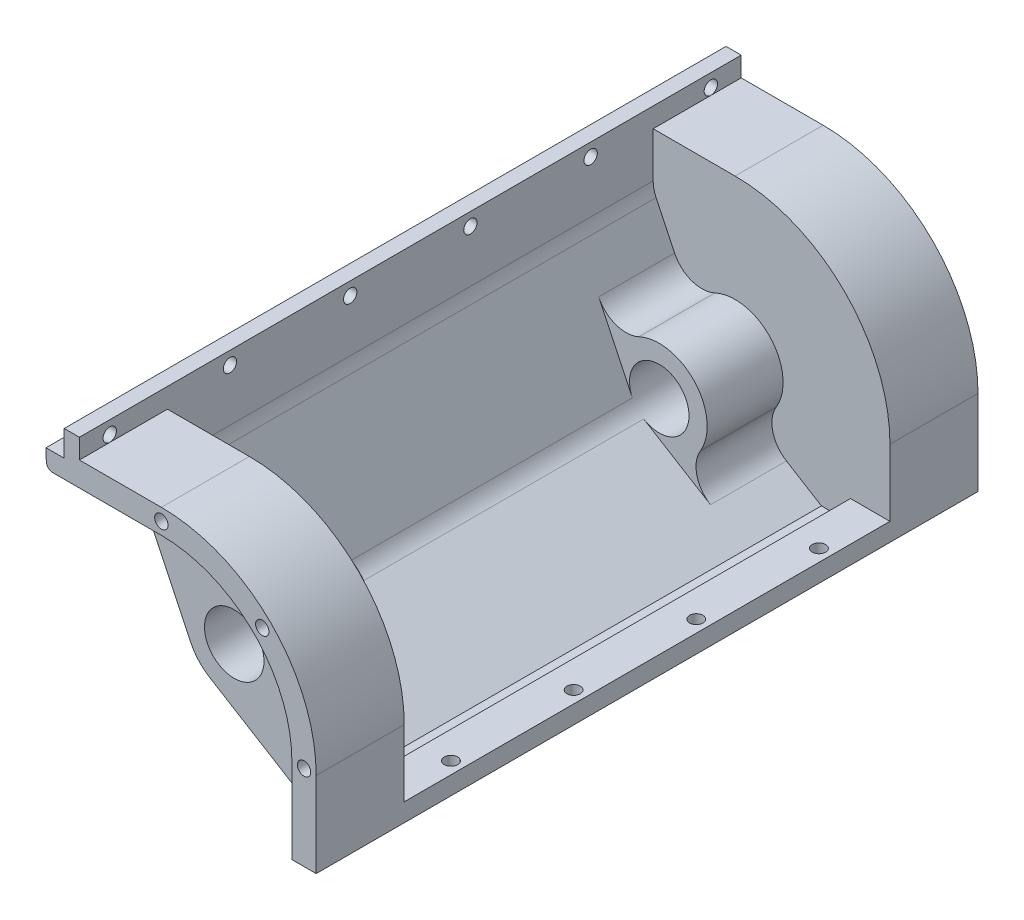
from build123d import *

# Parameters (mm, degrees)
EXTRUDE_1_DEPTH          = 24
SKETCH_3_W               = 8
SKETCH_3_H               = 5
SKETCH_3_H_2             = 6
EXTRUDE_2_DEPTH          = 5
SKETCH_3_4_W             = 8
SKETCH_3_4_H             = 6
EXTRUDE_3_DEPTH          = 85
SKETCH_3_5_W             = 8
SKETCH_3_5_H             = 5
EXTRUDE_5_DEPTH          = 30
SKETCH_4_R               = 15.8
SKETCH_4_R_2             = 9.8
EXTRUDE_4_DEPTH          = 30
FILLET_1_R               = 10
FILLET_2_R               = 4.5
FILLET_3_R               = 20
FILLET_4_R               = 8
FILLET_5_R               = 2
CUT_EXTRUDE_1_DEPTH      = 414.364246156
CUT_EXTRUDE_1_DEPTH_BACK = 414.364246156
SKETCH_5_R               = 2.2
SKETCH_7_R               = 2.2
CUT_EXTRUDE_2_DEPTH      = 10
SKETCH_8_R               = 2.2
CUT_EXTRUDE_3_DEPTH      = 10


with BuildPart() as part:
    # Эскиз1 → Бобышка-Вытянуть1 (new body)
    with BuildSketch(Plane.XY):
        with BuildLine():
            Line((-62, -308), (-94, -308))
            Line((-94, -308), (-100, -308))
            Line((-100, -308), (-100, -302))
            Line((-100, -302), (-94, -302))
            Line((-94, -302), (-94, -293.5))
            Line((-94, -293.5), (-89, -293.5))
            Line((-89, -293.5), (-89, -300))
            Line((-89, -300), (-62, -300))
            ThreePointArc((-62, -300), (-25.937554159, -314.937554159), (-11, -351))
            Line((-11, -351), (-11, -379))
            Line((-11, -379), (-19, -379))
            Line((-19, -379), (-19, -351))
            ThreePointArc((-19, -351), (-31.594408409, -320.594408409), (-62, -308))
        make_face()
    extrude(amount=EXTRUDE_1_DEPTH)

    # Эскиз3 → Бобышка-Вытянуть2 (add)
    with BuildSketch(Plane.XY.offset(24)):
        with BuildLine():
            Line((-19, -351), (-19, -373))
            Line((-19, -373), (-11, -373))
            Line((-11, -373), (-11, -351))
            ThreePointArc((-11, -351), (-25.937554159, -314.937554159), (-62, -300))
            Line((-62, -300), (-89, -300))
            Line((-89, -300), (-89, -308))
            Line((-89, -308), (-62, -308))
            ThreePointArc((-62, -308), (-31.594408409, -320.594408409), (-19, -351))
        make_face()
        with BuildLine():
            Line((-24, -373), (-19, -373))
            Line((-19, -373), (-19, -351))
            ThreePointArc((-19, -351), (-31.594408409, -320.594408409), (-62, -308))
            Line((-62, -308), (-89, -308))
            Line((-89, -308), (-89, -317.132562387))
            Line((-89, -317.132562387), (-70.846385997, -355.21680623))
            ThreePointArc((-70.846385997, -355.21680623), (-64.161644886, -341.441376072), (-52.2, -351))
            ThreePointArc((-52.2, -351), (-57.209156829, -359.549141578), (-67.115881983, -359.358693172))
            Line((-67.115881983, -359.358693172), (-33.582731203, -379.882432752))
            Line((-33.582731203, -379.882432752), (-24, -379.882432752))
            Line((-24, -379.882432752), (-24, -373))
        make_face()
        with BuildLine():
            Line((-19, -385), (-19, -379))
            Line((-19, -379), (-19, -373))
            Line((-19, -373), (-24, -373))
            Line((-24, -373), (-24, -379.882432752))
            Line((-24, -379.882432752), (-33.582731203, -379.882432752))
            Line((-33.582731203, -379.882432752), (-67.115881983, -359.358693172))
            ThreePointArc((-67.115881983, -359.358693172), (-69.281829347, -357.558579218), (-70.846385997, -355.21680623))
            Line((-70.846385997, -355.21680623), (-89, -317.132562387))
            Line((-89, -317.132562387), (-89, -308))
            Line((-89, -308), (-100, -308))
            Line((-100, -308), (-76.26254069, -357.79852433))
            ThreePointArc((-76.26254069, -357.79852433), (-73.740092213, -361.574035882), (-70.248054625, -364.47626042))
            Line((-70.248054625, -364.47626042), (-36.714903846, -385))
            Line((-36.714903846, -385), (-28.714903846, -385))
            Line((-28.714903846, -385), (-19, -385))
        make_face()
        with Locations((-32.714903846, -387.5)):
            Rectangle(SKETCH_3_W, SKETCH_3_H)
        Polygon((-100, -308), (-89, -308), (-89, -300), (-89, -293.5), (-94, -293.5), (-94, -302), (-100, -302), align=None)
        with Locations((-15, -376)):
            Rectangle(SKETCH_3_W, SKETCH_3_H_2)
    extrude(amount=EXTRUDE_2_DEPTH)

    # Эскиз3<4> → Бобышка-Вытянуть3 (add)
    with BuildSketch(Plane.XY.offset(24)):
        with BuildLine():
            Line((-19, -385), (-19, -379))
            Line((-19, -379), (-19, -373))
            Line((-19, -373), (-24, -373))
            Line((-24, -373), (-24, -379.882432752))
            Line((-24, -379.882432752), (-33.582731203, -379.882432752))
            Line((-33.582731203, -379.882432752), (-67.115881983, -359.358693172))
            ThreePointArc((-67.115881983, -359.358693172), (-69.281829347, -357.558579218), (-70.846385997, -355.21680623))
            Line((-70.846385997, -355.21680623), (-89, -317.132562387))
            Line((-89, -317.132562387), (-89, -308))
            Line((-89, -308), (-100, -308))
            Line((-100, -308), (-76.26254069, -357.79852433))
            ThreePointArc((-76.26254069, -357.79852433), (-73.740092213, -361.574035882), (-70.248054625, -364.47626042))
            Line((-70.248054625, -364.47626042), (-36.714903846, -385))
            Line((-36.714903846, -385), (-28.714903846, -385))
            Line((-28.714903846, -385), (-19, -385))
        make_face()
        Polygon((-100, -308), (-89, -308), (-89, -300), (-89, -293.5), (-94, -293.5), (-94, -302), (-100, -302), align=None)
        with Locations((-15, -376)):
            Rectangle(SKETCH_3_4_W, SKETCH_3_4_H)
    extrude(amount=EXTRUDE_3_DEPTH)

    # Эскиз3<5> → Бобышка-Вытянуть5 (add)
    with BuildSketch(Plane.XY.offset(24)):
        with Locations((-32.714903846, -387.5)):
            Rectangle(SKETCH_3_5_W, SKETCH_3_5_H)
    extrude(amount=EXTRUDE_5_DEPTH)

    # Эскиз4 → Бобышка-Вытянуть4 (add)
    with BuildSketch(Plane(origin=(0, 0, 24), x_dir=(-1, 0, 0), z_dir=(0, 0, -1))):
        with Locations((62, -351)):
            Circle(SKETCH_4_R)
        with Locations(Location((62, -351, 0), (0, 0, 334.514265995))):
            Circle(SKETCH_4_R_2, mode=Mode.SUBTRACT)
    extrude(amount=-EXTRUDE_4_DEPTH)

    # Скругление1
    fillet_1_edges = [part.edges().sort_by_distance(p)[0] for p in [
        (-89, -317.132562387, 69),
        (-56.545080529, -365.828481162, 41.5),
        (-76.179159974, -344.029245204, 41.5),
    ]]
    fillet(fillet_1_edges, radius=FILLET_1_R)

    # Скругление2
    fillet_2_edges = [part.edges().sort_by_distance(p)[0] for p in [
        (-36.714903846, -385, 39),
        (-28.714903846, -385, 39),
    ]]
    fillet(fillet_2_edges, radius=FILLET_2_R)

    # Скругление3
    # the kernel refuses this fillet: 20 mm, written as the material it takes off along each edge
    with BuildSketch(Plane(origin=(-100, -308, -3.137524006), x_dir=(0, 1, 0), z_dir=(0, 0, 1))) as fillet_3_piece_1:
        with BuildLine():
            CenterArc((FILLET_3_R * 0.226146033386, -FILLET_3_R), FILLET_3_R, 90, 25.485734005)
            Line((-FILLET_3_R * 0.204140316645, -FILLET_3_R * 0.0973075512795), (-FILLET_3_R * 0.212746043646, -FILLET_3_R * 0.0792537023051))
            Line((-FILLET_3_R * 0.212746043646, -FILLET_3_R * 0.0792537023051), (-FILLET_3_R * 0.00452292066771, FILLET_3_R * 0.02))
            Line((-FILLET_3_R * 0.00452292066771, FILLET_3_R * 0.02), (FILLET_3_R * 0.226146033386, FILLET_3_R * 0.02))
            Line((FILLET_3_R * 0.226146033386, FILLET_3_R * 0.02), (FILLET_3_R * 0.226146033386, 0))
        make_face()
    extrude(amount=139.275048013, mode=Mode.SUBTRACT)

    # Скругление4
    fillet_4_edges = [part.edges().sort_by_distance(p)[0] for p in [
        (-36.714903846, -385, 81.5),
    ]]
    fillet(fillet_4_edges, radius=FILLET_4_R)

    # Скругление5
    fillet_5_edges = [part.edges().sort_by_distance(p)[0] for p in [
        (-99.481868202, -308, 12),
    ]]
    fillet(fillet_5_edges, radius=FILLET_5_R)

    # Эскиз5 → Вырез-Вытянуть1 (cut, two sides: drawn at the far end of the back side and taken through both)
    with BuildSketch(Plane.ZY.offset(94).offset(-CUT_EXTRUDE_1_DEPTH_BACK)):
        with Locations((89.2, -297.75)):
            Circle(SKETCH_5_R)
        with Locations((10, -297.75)):
            Circle(SKETCH_5_R)
        with Locations((49.6, -297.75)):
            Circle(SKETCH_5_R)
    extrude(amount=CUT_EXTRUDE_1_DEPTH + CUT_EXTRUDE_1_DEPTH_BACK, mode=Mode.SUBTRACT)

    # Эскиз7 → Вырез-Вытянуть2 (cut)
    with BuildSketch(Plane.XZ.offset(379)):
        with Locations(Location((-15, 88.8, 0), (0, 0, 270))):
            Circle(SKETCH_7_R)
        with Locations(Location((-15, 48.4, 0), (0, 0, 270))):
            Circle(SKETCH_7_R)
        with Locations(Location((-15, 8, 0), (0, 0, 270))):
            Circle(SKETCH_7_R)
    extrude(amount=-CUT_EXTRUDE_2_DEPTH, mode=Mode.SUBTRACT)

    # Эскиз8 → Вырез-Вытянуть3 (cut)
    with BuildSketch(Plane(origin=(0, 0, 0), x_dir=(-1, 0, 0), z_dir=(0, 0, -1))):
        with Locations((62, -304)):
            Circle(SKETCH_8_R)
        with Locations((28.765981284, -317.765981284)):
            Circle(SKETCH_8_R)
        with Locations((15, -351)):
            Circle(SKETCH_8_R)
    extrude(amount=-CUT_EXTRUDE_3_DEPTH, mode=Mode.SUBTRACT)

    # Зеркальное отражение1: part across plane


with BuildPart() as part_1:
    add(part.part)
    add(part.part.mirror(Plane(origin=(0, 0, 109), x_dir=(1, 0, 0), z_dir=(0, 0, -1))))


solid = part_1.part
